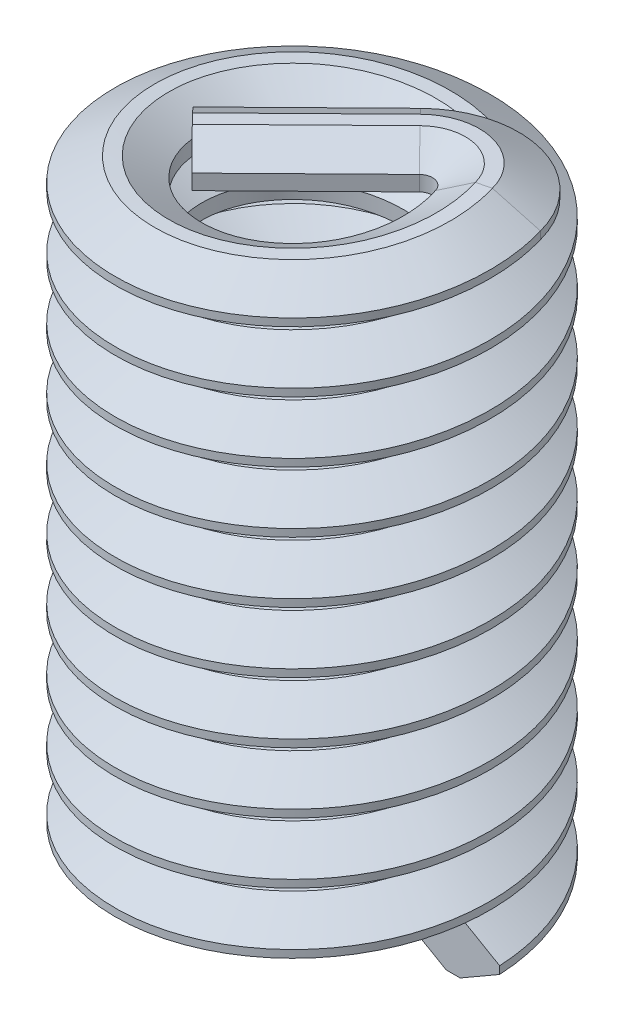
from build123d import *

# Parameters (mm, degrees)
SWEEP1_PITCH       = 0.79375
SWEEP1_HEIGHT      = 7.96925
SWEEP1_RADIUS      = 1.7526
SWEEP1_START_ANGLE = 90
REVOLVE1_ANGLE     = 120
EXTRUDE1_DEPTH     = 2.10312


with BuildPart() as part:
    # Sweep1: sweep along a helix
    with BuildLine() as sweep1_path:
        add(Helix(SWEEP1_PITCH, SWEEP1_HEIGHT, SWEEP1_RADIUS, center=(0, 0, 0), direction=(0, 1, 0), mode=Mode.PRIVATE).rotate(Axis((0, 0, 0), (0, 1, 0)), SWEEP1_START_ANGLE))
    # Sketch1 → Sweep1 (sweep)
    with BuildSketch(Plane(origin=(0, 0, 0), x_dir=(-1, 0, 0), z_dir=(0, 0, 1))):
        Polygon((-2.4511, -0.049609375), (-1.935544252, -0.347265625), (-1.7526, -0.347265625), (-1.32297021, -0.09921875), (-1.32297021, 0.09921875), (-1.7526, 0.347265625), (-1.935544252, 0.347265625), (-2.4511, 0.049609375), align=None)
    sweep(path=sweep1_path.line, is_frenet=True)


with BuildPart() as body_2:
    # Sketch3 → Revolve1 (revolve)
    with BuildSketch(Plane(origin=(0, 0, 0), x_dir=(-0.9685758181417967, 0, 0.24871848445772812), z_dir=(-0.24871848445772812, 0, -0.9685758181417967))):
        Polygon((-1.7526, 7.621580921), (-1.32297021, 7.869628606), (-1.32297021, 8.068065296), (-1.7526, 8.316110971), (-1.935544251, 8.316110637), (-2.451099999, 8.018454053), (-2.4511, 7.919235637), (-1.935544252, 7.62158011), align=None)
    revolve(axis=Axis((1.114945893, 7.968847353, -0.286304539), (-2.5765147154130137e-10, 1.0, 6.616180411595107e-11)), revolution_arc=REVOLVE1_ANGLE)

    # Sketch4 → Extrude1 (add)
    with BuildSketch(Plane(origin=(0.712235919, 0, -0.697514139), x_dir=(0.6996844350020597, -1.8233740587839659e-09, 0.714452021773225), z_dir=(-0.714452021773225, -2.303719992871157e-10, 0.6996844350020597))):
        Polygon((-0.208865974, 7.621580109), (-0.025921722, 7.62158092), (0.403708068, 7.869628607), (0.403708067, 8.068065296), (-0.025921723, 8.316110971), (-0.208865975, 8.316110636), (-0.724421722, 8.018454051), (-0.724421722, 7.919235635), align=None)
    extrude(amount=EXTRUDE1_DEPTH)


solid = Compound([part.part, body_2.part])
